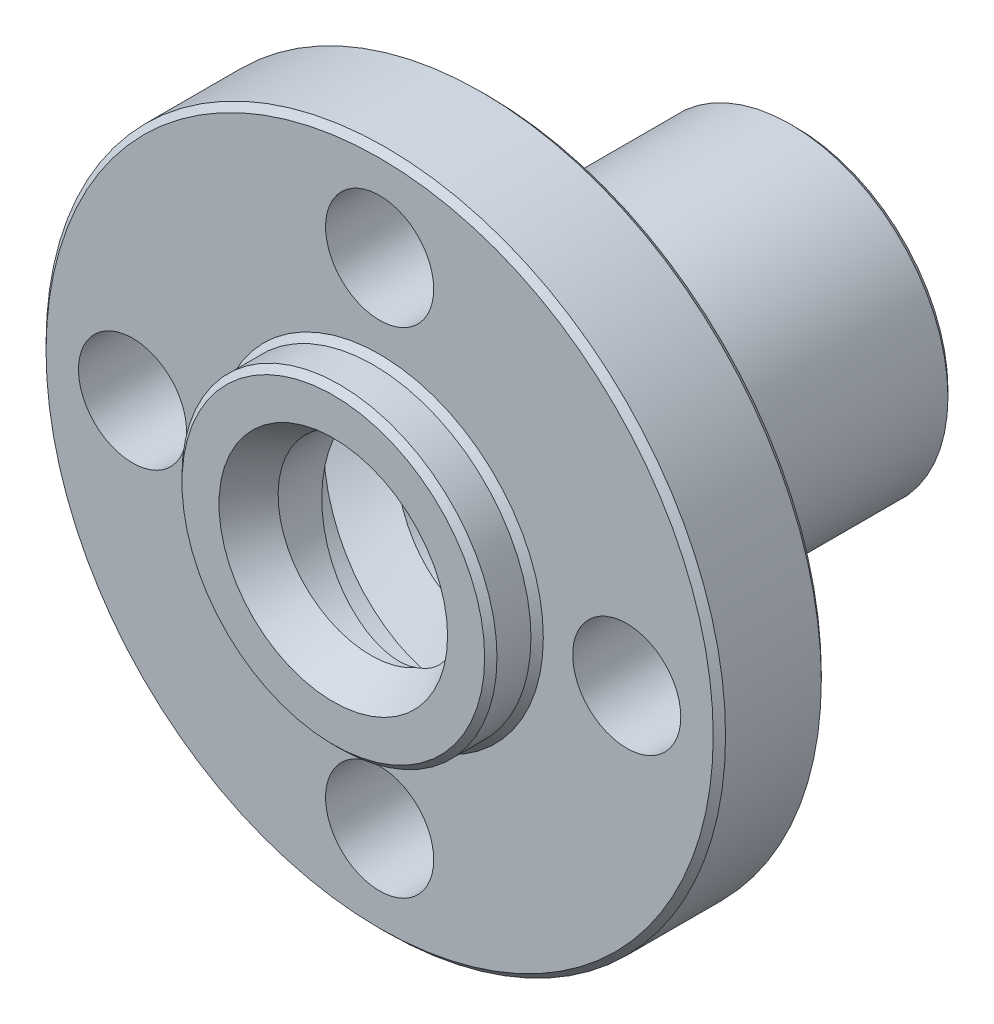
from build123d import *
from OCP.BRepFilletAPI import BRepFilletAPI_MakeChamfer

# Parameters (mm, degrees)
ESQUISSE1_R                           = 11
ESQUISSE1_R_2                         = 5.1
ESQUISSE1_R_3                         = 1.75
BOSS_EXTRU_1_DEPTH                    = 3.5
BOSS_EXTRU_2_DEPTH                    = 1.5
BOSS_EXTRU_2_DEPTH_BACK               = 13.5
ESQUISSE2_R                           = 5.1
ESQUISSE2_R_2                         = 3
CHANFREIN2_SIZE                       = 0.7
CHANFREIN2_SIZE2                      = 1.212435565
ENL_VEMENT_DE_MATI_RE_BALAYAGE1_PITCH = 4.5
CHANFREIN3_SIZE                       = 0.2


with BuildPart() as part:
    # Esquisse1 → Boss.-Extru.1 (new body)
    with BuildSketch(Plane.XY):
        Circle(ESQUISSE1_R)
        Circle(ESQUISSE1_R_2, mode=Mode.SUBTRACT)
        with Locations((0, 8)):
            Circle(ESQUISSE1_R_3, mode=Mode.SUBTRACT)
        with Locations((8, 0)):
            Circle(ESQUISSE1_R_3, mode=Mode.SUBTRACT)
        with Locations((0, -8)):
            Circle(ESQUISSE1_R_3, mode=Mode.SUBTRACT)
        with Locations((-8, 0)):
            Circle(ESQUISSE1_R_3, mode=Mode.SUBTRACT)
    extrude(amount=BOSS_EXTRU_1_DEPTH)

    # Esquisse2 → Boss.-Extru.2 (add, two sides: drawn at the far end of the back side and taken through both)
    with BuildSketch(Plane.XY.offset(3.5).offset(-BOSS_EXTRU_2_DEPTH_BACK)):
        Circle(ESQUISSE2_R)
        Circle(ESQUISSE2_R_2, mode=Mode.SUBTRACT)
    extrude(amount=BOSS_EXTRU_2_DEPTH + BOSS_EXTRU_2_DEPTH_BACK)

    # Chanfrein2: one chamfer whose edges measure the first distance from different faces: ONE call of the kernel's chamfer builder (chamfer() names one face for all edges)
    chanfrein2_edges_1 = [part.edges().sort_by_distance(p)[0] for p in [
        (-3, 0, -10),
    ]]
    chanfrein2_side_1 = [part.faces().sort_by_distance(p)[0] for p in [
        (-3, 0, -3.25),
    ]]
    chanfrein2_edges_2 = [part.edges().sort_by_distance(p)[0] for p in [
        (-3, 0, 5),
    ]]
    chanfrein2_side_2 = [part.faces().sort_by_distance(p)[0] for p in [
        (-4.955750217, 0, 5),
    ]]
    chanfrein2 = BRepFilletAPI_MakeChamfer(part.part.solid().wrapped)
    for e in chanfrein2_edges_1:
        chanfrein2.Add(CHANFREIN2_SIZE, CHANFREIN2_SIZE2, e.wrapped, chanfrein2_side_1[0].wrapped)  # the first distance lies on this face
    for e in chanfrein2_edges_2:
        chanfrein2.Add(CHANFREIN2_SIZE, CHANFREIN2_SIZE2, e.wrapped, chanfrein2_side_2[0].wrapped)  # the first distance lies on this face
    add(Compound.cast(chanfrein2.Shape()), mode=Mode.REPLACE)

    # Enlèvement de matière-Balayage1: arcs per turn and ends read off the stored shape
    # Enlèvement de matière-Balayage1: the profile of Esquisse6 screwed along a right-hand helix through 5.555556 turns, 12 arcs to a turn; built about Z, then put on its axis
    enl_vement_de_mati_re_balayage1_z = Axis((0, 0, 0), (0, 0, 1))
    enl_vement_de_mati_re_balayage1_corners = [(4.5, 1.2566e-05, 0.492005646), (4.5, 1.2566e-05, -0.171321177), (2.257915532, 6.305e-06, -1.465789248), (2.257915532, 6.305e-06, 1.786473717)]
    with BuildLine(mode=Mode.PRIVATE) as enl_vement_de_mati_re_balayage1_profile:
        Line(enl_vement_de_mati_re_balayage1_corners[0], enl_vement_de_mati_re_balayage1_corners[1])
        Line(enl_vement_de_mati_re_balayage1_corners[1], enl_vement_de_mati_re_balayage1_corners[2])
        Line(enl_vement_de_mati_re_balayage1_corners[2], enl_vement_de_mati_re_balayage1_corners[3])
        Line(enl_vement_de_mati_re_balayage1_corners[3], enl_vement_de_mati_re_balayage1_corners[0])
    enl_vement_de_mati_re_balayage1_cap = Face(enl_vement_de_mati_re_balayage1_profile.wire())
    enl_vement_de_mati_re_balayage1_turn_angles = [0, 15, 30, 45, 60, 75, 90, 105, 120, 135, 150, 165, 180, 195, 210, 225, 240, 255, 270, 285, 300, 315, 330, 345, 360]
    enl_vement_de_mati_re_balayage1_turn_weights = [1, 0.9659258262890683, 1, 0.9659258262890683, 1, 0.9659258262890683, 1, 0.9659258262890683, 1, 0.9659258262890683, 1, 0.9659258262890683, 1, 0.9659258262890683, 1, 0.9659258262890683, 1, 0.9659258262890683, 1, 0.9659258262890683, 1, 0.9659258262890683, 1, 0.9659258262890683, 1]
    enl_vement_de_mati_re_balayage1_turn_rails = [Edge.make_bspline([Vector(p[0], p[1], 0).rotate(enl_vement_de_mati_re_balayage1_z, enl_vement_de_mati_re_balayage1_turn_angles[k]) / enl_vement_de_mati_re_balayage1_turn_weights[k] + Vector(0, 0, p[2] + ENL_VEMENT_DE_MATI_RE_BALAYAGE1_PITCH * enl_vement_de_mati_re_balayage1_turn_angles[k] / 360) for k in range(25)], [0, 0, 0, 1, 1, 2, 2, 3, 3, 4, 4, 5, 5, 6, 6, 7, 7, 8, 8, 9, 9, 10, 10, 11, 11, 12, 12, 12], 2, enl_vement_de_mati_re_balayage1_turn_weights) for p in enl_vement_de_mati_re_balayage1_corners]
    enl_vement_de_mati_re_balayage1_turn_sides = [Face.make_surface_from_curves(enl_vement_de_mati_re_balayage1_turn_rails[p[0]], enl_vement_de_mati_re_balayage1_turn_rails[p[1]]) for p in [(0, 1), (1, 2), (2, 3), (3, 0)]]
    enl_vement_de_mati_re_balayage1_last_angles = [1800, 1815, 1830, 1845, 1860, 1875, 1890, 1905, 1920, 1935, 1950, 1965, 1980, 1990, 2000]
    enl_vement_de_mati_re_balayage1_last_weights = [1, 0.9659258262890683, 1, 0.9659258262890683, 1, 0.9659258262890683, 1, 0.9659258262890683, 1, 0.9659258262890683, 1, 0.9659258262890683, 1, 0.9848077530122046, 1]
    enl_vement_de_mati_re_balayage1_last_rails = [Edge.make_bspline([Vector(p[0], p[1], 0).rotate(enl_vement_de_mati_re_balayage1_z, enl_vement_de_mati_re_balayage1_last_angles[k]) / enl_vement_de_mati_re_balayage1_last_weights[k] + Vector(0, 0, p[2] + ENL_VEMENT_DE_MATI_RE_BALAYAGE1_PITCH * enl_vement_de_mati_re_balayage1_last_angles[k] / 360) for k in range(15)], [0, 0, 0, 1, 1, 2, 2, 3, 3, 4, 4, 5, 5, 6, 6, 7, 7, 7], 2, enl_vement_de_mati_re_balayage1_last_weights) for p in enl_vement_de_mati_re_balayage1_corners]
    enl_vement_de_mati_re_balayage1_last_sides = [Face.make_surface_from_curves(enl_vement_de_mati_re_balayage1_last_rails[p[0]], enl_vement_de_mati_re_balayage1_last_rails[p[1]]) for p in [(0, 1), (1, 2), (2, 3), (3, 0)]]
    enl_vement_de_mati_re_balayage1 = Plane(origin=(0, 0, 3.5), x_dir=(1, 0, 0), z_dir=(0, 0, -1)) * Solid(Shell([*[p.moved(Location((0, 0, ENL_VEMENT_DE_MATI_RE_BALAYAGE1_PITCH * i))) for i in range(5) for p in enl_vement_de_mati_re_balayage1_turn_sides], *enl_vement_de_mati_re_balayage1_last_sides, enl_vement_de_mati_re_balayage1_cap, enl_vement_de_mati_re_balayage1_cap.rotate(enl_vement_de_mati_re_balayage1_z, 2000).moved(Location((0, 0, ENL_VEMENT_DE_MATI_RE_BALAYAGE1_PITCH * 2000 / 360)))]))
    add(enl_vement_de_mati_re_balayage1, mode=Mode.SUBTRACT)

    # Chanfrein3
    chanfrein3_edges = [part.edges().sort_by_distance(p)[0] for p in [
        (-11, 0, 0),
        (-5.1, 0, 0),
        (-5.1, 0, -10),
        (-5.1, 0, 5),
        (-11, 0, 3.5),
        (-5.1, 0, 3.5),
    ]]
    chamfer(chanfrein3_edges, length=CHANFREIN3_SIZE)


solid = part.part
